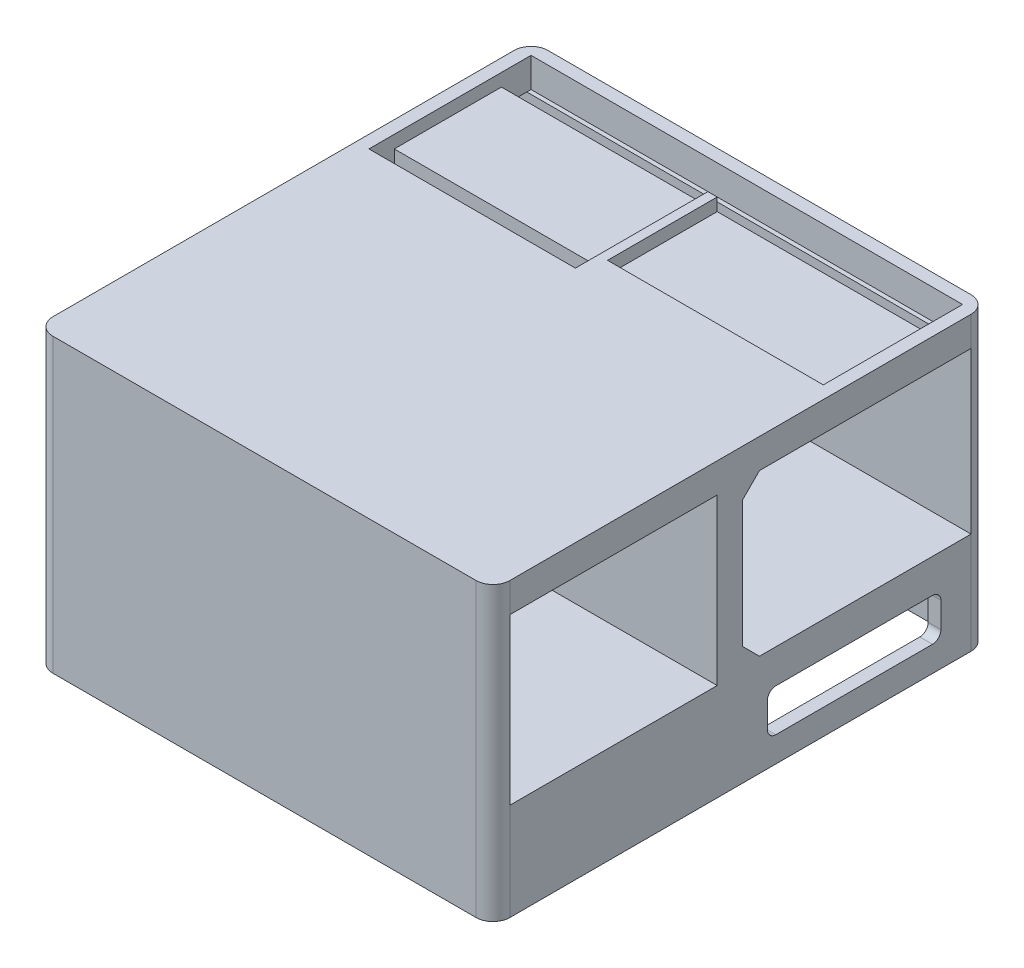
from build123d import *

# Parameters (mm, degrees)
BOSS_EXTRUDE4_DEPTH = 21
BOSS_EXTRUDE5_START = 3.5
BOSS_EXTRUDE5_DEPTH = 3.5
SKETCH4_W           = 27
SKETCH4_H           = 19
CUT_EXTRUDE4_DEPTH  = 72.268857154
SKETCH3_5_W         = 24.4
SKETCH3_5_H         = 12.66
BOSS_EXTRUDE6_DEPTH = 2
SKETCH5_W           = 51
SKETCH5_H           = 29
BOSS_EXTRUDE7_DEPTH = 10
CUT_EXTRUDE5_DEPTH  = 75.828136419
CUT_EXTRUDE6_REACH  = 76.828
SKETCH8_W           = 24.5
SKETCH8_H           = 19.5
CHAMFER1_SIZE       = 2


with BuildPart() as part:
    # Sketch3 → Boss-Extrude4 (new body)
    with BuildSketch(Plane(origin=(0, 0, 0), x_dir=(1, 0, 0), z_dir=(0, 1, 0))):
        with BuildLine():
            Line((-27, 15), (-27, -39.5))
            ThreePointArc((-27, -39.5), (-26.414213562, -40.914213562), (-25, -41.5))
            Line((-25, -41.5), (25, -41.5))
            ThreePointArc((25, -41.5), (26.414213562, -40.914213562), (27, -39.5))
            Line((27, -39.5), (27, 15))
            ThreePointArc((27, 15), (26.414213562, 16.414213562), (25, 17))
            Line((25, 17), (-25, 17))
            ThreePointArc((-25, 17), (-26.414213562, 16.414213562), (-27, 15))
        make_face()
    extrude(amount=-BOSS_EXTRUDE4_DEPTH)

    # Sketch3<3> → Boss-Extrude5 (add)
    with BuildSketch(Plane(origin=(0, 0, 0), x_dir=(1, 0, 0), z_dir=(0, 1, 0)).offset(BOSS_EXTRUDE5_START)):
        with BuildLine():
            Line((-27, 15), (-27, -39.5))
            ThreePointArc((-27, -39.5), (-26.414213562, -40.914213562), (-25, -41.5))
            Line((-25, -41.5), (25, -41.5))
            ThreePointArc((25, -41.5), (26.414213562, -40.914213562), (27, -39.5))
            Line((27, -39.5), (27, 15))
            ThreePointArc((27, 15), (26.414213562, 16.414213562), (25, 17))
            Line((25, 17), (-25, 17))
            ThreePointArc((-25, 17), (-26.414213562, 16.414213562), (-27, 15))
        make_face()
        Polygon((0, 12), (-1.1, 12), (-1.1, -3.66), (-25.5, -3.66), (-25.5, 15.5), (25.5, 15.5), (25.5, -0.96), (0, -0.96), align=None, mode=Mode.SUBTRACT)
    extrude(amount=-BOSS_EXTRUDE5_DEPTH)

    # Sketch4 → Cut-Extrude4 (cut, through all)
    with BuildSketch(Plane.ZY.offset(27)):
        with Locations((-1.5, -9.5)):
            Rectangle(SKETCH4_W, SKETCH4_H)
    extrude(amount=-CUT_EXTRUDE4_DEPTH, mode=Mode.SUBTRACT)

    # Sketch3<5> → Boss-Extrude6 (add)
    with BuildSketch(Plane(origin=(0, 0, 0), x_dir=(1, 0, 0), z_dir=(0, 1, 0))):
        with Locations((-13.3, 5.67)):
            Rectangle(SKETCH3_5_W, SKETCH3_5_H)
        Polygon((25.5, 12), (0, 12), (0, -0.96), (25.5, -0.96), (25.5, -0.5), align=None)
    extrude(amount=BOSS_EXTRUDE6_DEPTH)

    # Sketch5 → Boss-Extrude7 (add)
    # profile 1 of 2: a face of its own
    with BuildSketch(Plane.XZ.offset(21)):
        with BuildLine():
            ThreePointArc((25, -17), (26.414213562, -16.414213562), (27, -15))
            Line((27, -15), (27, 39.5))
            ThreePointArc((27, 39.5), (26.414213562, 40.914213562), (25, 41.5))
            Line((25, 41.5), (-25, 41.5))
            ThreePointArc((-25, 41.5), (-26.414213562, 40.914213562), (-27, 39.5))
            Line((-27, 39.5), (-27, -15))
            ThreePointArc((-27, -15), (-26.414213562, -16.414213562), (-25, -17))
            Line((-25, -17), (25, -17))
        make_face()
        with Locations((0, -1)):
            Rectangle(SKETCH5_W, SKETCH5_H, mode=Mode.SUBTRACT)
    # profile 2 of 2: a face of its own
    with BuildSketch(Plane.XZ.offset(21)):
        with BuildLine():
            ThreePointArc((25, -17), (26.414213562, -16.414213562), (27, -15))
            Line((27, -15), (27, 39.5))
            ThreePointArc((27, 39.5), (26.414213562, 40.914213562), (25, 41.5))
            Line((25, 41.5), (-25, 41.5))
            ThreePointArc((-25, 41.5), (-26.414213562, 40.914213562), (-27, 39.5))
            Line((-27, 39.5), (-27, -15))
            ThreePointArc((-27, -15), (-26.414213562, -16.414213562), (-25, -17))
            Line((-25, -17), (25, -17))
        make_face()
        with Locations((0, -1)):
            Rectangle(SKETCH5_W, SKETCH5_H, mode=Mode.SUBTRACT)
    extrude(amount=BOSS_EXTRUDE7_DEPTH)

    # Sketch6 → Cut-Extrude5 (cut, through all)
    with BuildSketch(Plane.ZY.offset(27)):
        with BuildLine():
            Line((-10.438825699, -23), (8.061174301, -23))
            ThreePointArc((8.061174301, -23), (8.768281082, -23.292893219), (9.061174301, -24))
            Line((9.061174301, -24), (9.061174301, -27))
            ThreePointArc((9.061174301, -27), (8.768281082, -27.707106781), (8.061174301, -28))
            Line((8.061174301, -28), (-10.438825699, -28))
            ThreePointArc((-10.438825699, -28), (-11.14593248, -27.707106781), (-11.438825699, -27))
            Line((-11.438825699, -27), (-11.438825699, -24))
            ThreePointArc((-11.438825699, -24), (-11.14593248, -23.292893219), (-10.438825699, -23))
        make_face()
    extrude(amount=-CUT_EXTRUDE5_DEPTH, mode=Mode.SUBTRACT)

    # Sketch8 → Cut-Extrude6 (cut, up to next)
    with BuildSketch(Plane(origin=(27, 0, 0), x_dir=(0, 0, -1), z_dir=(1, 0, 0)), mode=Mode.PRIVATE) as cut_extrude6_sk1:
        with Locations((-27.25, -9.75)):
            Rectangle(SKETCH8_W, SKETCH8_H)
    cut_extrude6_tool1 = extrude(cut_extrude6_sk1.sketch, amount=-CUT_EXTRUDE6_REACH, mode=Mode.PRIVATE) & part.part
    add(cut_extrude6_tool1.solids().sort_by_distance((27, -9.75, 27.25))[0], mode=Mode.SUBTRACT)

    # Chamfer1
    chamfer1_edges = [part.edges().sort_by_distance(p)[0] for p in [
        (25.5, -26, -15.5),
        (-25.5, -21, -1),
        (-25.5, -26, -15.5),
        (0, -21, 13.5),
        (-25.5, -26, 13.5),
        (25.5, -26, 13.5),
        (0, -21, -15.5),
        (25.5, -21, -1),
        (0, 0, 12),
        (0, -19, 12),
    ]]
    chamfer(chamfer1_edges, length=CHAMFER1_SIZE - 0.0001)  # a hair under: the kernel refuses the full size


solid = part.part
